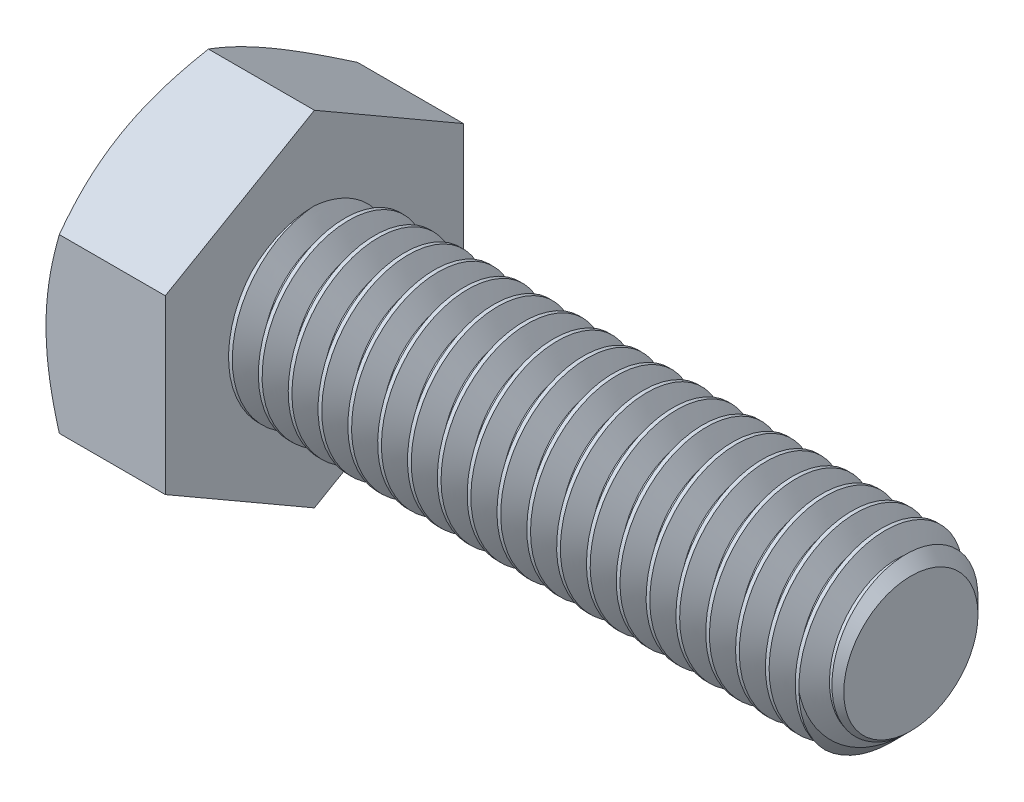
from build123d import *

# Parameters (mm, degrees)
SKETCH2_R           = 3
BOSS_EXTRUDE1_DEPTH = 20
CHAMFER1_SIZE       = 0.75
CUT_SWEEP1_PITCH    = 1
BOSS_EXTRUDE2_DEPTH = 4
SKETCH6_OUTSIDE_W   = 108.4
SKETCH6_OUTSIDE_H   = 109.948
SKETCH6_OUTSIDE_R   = 5
CUT_EXTRUDE1_DEPTH  = 26.185975071
CUT_EXTRUDE1_DRAFT  = -60


with BuildPart() as part:
    # Sketch2 → Boss-Extrude1 (new body)
    with BuildSketch(Plane(origin=(12, 0, 0), x_dir=(0, 0, -1), z_dir=(1, 0, 0))):
        Circle(SKETCH2_R)
    extrude(amount=-BOSS_EXTRUDE1_DEPTH)

    # Chamfer1
    chamfer1_edges = [part.edges().sort_by_distance(p)[0] for p in [
        (12, 0, 3),
    ]]
    chamfer(chamfer1_edges, length=CHAMFER1_SIZE)

    # Cut-Sweep1: the profile of Sketch5 profile screwed along a right-hand helix of 21 turns, 8 arcs to a turn; built about Z, then put on its axis
    cut_sweep1_z = Axis((0, 0, 0), (0, 0, 1))
    cut_sweep1_corners = [(3.0003, 0, 0.000173205), (2.350480947, 0, -0.375), (2.350480947, 0, -0.5), (3.0003, 0, -0.875173205)]
    with BuildLine(mode=Mode.PRIVATE) as cut_sweep1_profile:
        Line(cut_sweep1_corners[0], cut_sweep1_corners[1])
        Line(cut_sweep1_corners[1], cut_sweep1_corners[2])
        Line(cut_sweep1_corners[2], cut_sweep1_corners[3])
        Line(cut_sweep1_corners[3], cut_sweep1_corners[0])
    cut_sweep1_cap = Face(cut_sweep1_profile.wire())
    cut_sweep1_turn_angles = [0, 22.5, 45, 67.5, 90, 112.5, 135, 157.5, 180, 202.5, 225, 247.5, 270, 292.5, 315, 337.5, 360]
    cut_sweep1_turn_weights = [1, 0.9238795325112867, 1, 0.9238795325112867, 1, 0.9238795325112867, 1, 0.9238795325112867, 1, 0.9238795325112867, 1, 0.9238795325112867, 1, 0.9238795325112867, 1, 0.9238795325112867, 1]
    cut_sweep1_turn_rails = [Edge.make_bspline([Vector(p[0], p[1], 0).rotate(cut_sweep1_z, cut_sweep1_turn_angles[k]) / cut_sweep1_turn_weights[k] + Vector(0, 0, p[2] + CUT_SWEEP1_PITCH * cut_sweep1_turn_angles[k] / 360) for k in range(17)], [0, 0, 0, 1, 1, 2, 2, 3, 3, 4, 4, 5, 5, 6, 6, 7, 7, 8, 8, 8], 2, cut_sweep1_turn_weights) for p in cut_sweep1_corners]
    cut_sweep1_turn_sides = [Face.make_surface_from_curves(cut_sweep1_turn_rails[p[0]], cut_sweep1_turn_rails[p[1]]) for p in [(0, 1), (1, 2), (2, 3), (3, 0)]]
    cut_sweep1 = Plane(origin=(12, 0, 0), x_dir=(0, 1, 0), z_dir=(-1, 0, 0)) * Solid(Shell([*[p.moved(Location((0, 0, CUT_SWEEP1_PITCH * i))) for i in range(21) for p in cut_sweep1_turn_sides], cut_sweep1_cap, cut_sweep1_cap.rotate(cut_sweep1_z, 7560).moved(Location((0, 0, CUT_SWEEP1_PITCH * 7560 / 360)))]))
    add(cut_sweep1, mode=Mode.SUBTRACT)

    # Sketch3 → Boss-Extrude2 (add)
    with BuildSketch(Plane.ZY.offset(8)):
        Polygon((-5, -2.886751346), (0, -5.773502692), (5, -2.886751346), (5, 2.886751346), (0, 5.773502692), (-5, 2.886751346), align=None)
    extrude(amount=BOSS_EXTRUDE2_DEPTH)


with BuildPart() as cut_extrude1_tool:
    # Sketch6 outside → Cut-Extrude1 (with draft: the straight prism first)
    with BuildSketch(Plane.ZY.offset(12)):
        Rectangle(SKETCH6_OUTSIDE_W, SKETCH6_OUTSIDE_H)
        Circle(SKETCH6_OUTSIDE_R, mode=Mode.SUBTRACT)
    extrude(amount=-CUT_EXTRUDE1_DEPTH)
    # Cut-Extrude1: the draft: its side faces are tilted about the plane it starts from
    cut_extrude1_sides = [cut_extrude1_tool.faces().sort_by_distance(p)[0] for p in [
        (1.092987536, -54.974, 0),
        (1.092987536, 0, 54.2),
        (1.092987536, 54.974, 0),
        (1.092987536, 0, -54.2),
        (1.092987536, 0, -5),
    ]]
    draft(cut_extrude1_sides, Plane.ZY.offset(12), CUT_EXTRUDE1_DRAFT)


with BuildPart() as part_1:
    add(part.part)

    # Cut-Extrude1: cut by cut_extrude1_tool
    add(cut_extrude1_tool.part, mode=Mode.SUBTRACT)


solid = part_1.part
